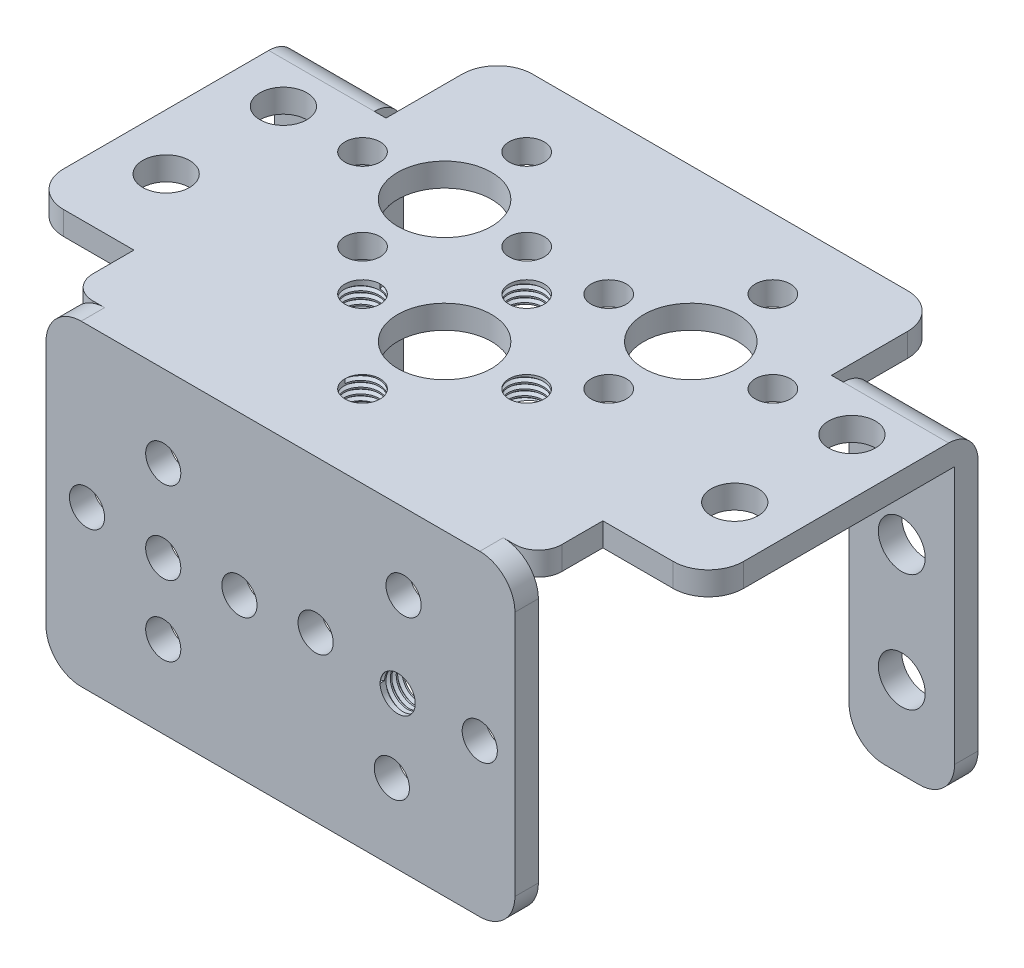
from build123d import *
from build123d.topology import SkipClean

# Parameters (mm, degrees)
SKETCH1_W           = 40
SKETCH1_H           = 27
SKETCH1_R           = 1.5
BOSS_EXTRUDE1_DEPTH = 2
FILLET1_R           = 3
SKETCH3_R           = 2
SKETCH3_R_2         = 4
SKETCH3_R_3         = 1.5
BOSS_EXTRUDE4_DEPTH = 2
FILLET2_R           = 3
FILLET4_R           = 2
SKETCH10_R          = 2
BOSS_EXTRUDE5_DEPTH = 2
FILLET5_R           = 2.5
THREAD1_PITCH       = 0.5
CIRPATTERN1_COUNT   = 4
THREAD2_PITCH       = 0.5


with BuildPart() as part:
    # Sketch1 → Boss-Extrude1 (new body)
    with BuildSketch(Plane.XY):
        Rectangle(SKETCH1_W, SKETCH1_H)
        with Locations((-10, -0.5)):
            Circle(SKETCH1_R, mode=Mode.SUBTRACT)
        with Locations(Location((10, -0.5, 0), (0, 0, 180))):
            Circle(SKETCH1_R, mode=Mode.SUBTRACT)
        with Locations((-10, 6.5)):
            Circle(SKETCH1_R, mode=Mode.SUBTRACT)
        with Locations((-3.5, 0)):
            Circle(SKETCH1_R, mode=Mode.SUBTRACT)
        with Locations((-10, -6.5)):
            Circle(SKETCH1_R, mode=Mode.SUBTRACT)
        with Locations((-16.5, 0)):
            Circle(SKETCH1_R, mode=Mode.SUBTRACT)
        with Locations((17, -0.5)):
            Circle(SKETCH1_R, mode=Mode.SUBTRACT)
        with Locations((9.5, -7)):
            Circle(SKETCH1_R, mode=Mode.SUBTRACT)
        with Locations((3, 0.5)):
            Circle(SKETCH1_R, mode=Mode.SUBTRACT)
        with Locations((10.5, 7)):
            Circle(SKETCH1_R, mode=Mode.SUBTRACT)
    extrude(amount=BOSS_EXTRUDE1_DEPTH)

    # Fillet1
    fillet1_edges = [part.edges().sort_by_distance(p)[0] for p in [
        (20, -13.5, 1),
        (-20, -13.5, 1),
        (-20, 13.5, 1),
        (20, 13.5, 1),
    ]]
    fillet(fillet1_edges, radius=FILLET1_R)

    # Sketch3 → Boss-Extrude4 (add)
    with BuildSketch(Plane(origin=(0, 13.5, 0), x_dir=(1, 0, 0), z_dir=(0, 1, 0))):
        with BuildLine():
            Line((-20, 0), (-20, 5.5))
            Line((-20, 5.5), (-26, 5.5))
            ThreePointArc((-26, 5.5), (-28.121320344, 6.378679656), (-29, 8.5))
            Line((-29, 8.5), (-29, 28.5))
            Line((-29, 28.5), (-20, 28.5))
            Line((-20, 28.5), (-20, 26))
            Line((-20, 26), (-19, 26))
            Line((-19, 26), (-19, 35.5))
            Line((-19, 35.5), (19, 35.5))
            Line((19, 35.5), (19, 26))
            Line((19, 26), (20, 26))
            Line((20, 26), (20, 28.5))
            Line((20, 28.5), (29, 28.5))
            Line((29, 28.5), (29, 8.5))
            ThreePointArc((29, 8.5), (28.121320344, 6.378679656), (26, 5.5))
            Line((26, 5.5), (20, 5.5))
            Line((20, 5.5), (20, 0))
            Line((20, 0), (-20, 0))
        make_face()
        with Locations(Location((-24.25, 22.5, 0), (0, 0, 270))):
            Circle(SKETCH3_R, mode=Mode.SUBTRACT)
        with Locations(Location((-24.25, 12.5, 0), (0, 0, 270))):
            Circle(SKETCH3_R, mode=Mode.SUBTRACT)
        with Locations(Location((24.25, 12.5, 0), (0, 0, 90))):
            Circle(SKETCH3_R, mode=Mode.SUBTRACT)
        with Locations(Location((24.25, 22.5, 0), (0, 0, 90))):
            Circle(SKETCH3_R, mode=Mode.SUBTRACT)
        with Locations(Location((-10.5, 22.5, 0), (0, 0, 270))):
            Circle(SKETCH3_R_2, mode=Mode.SUBTRACT)
        with Locations(Location((10.5, 22.5, 0), (0, 0, 90))):
            Circle(SKETCH3_R_2, mode=Mode.SUBTRACT)
        with Locations(Location((-10.5, 29.5, 0), (0, 0, 270))):
            Circle(SKETCH3_R_3, mode=Mode.SUBTRACT)
        with Locations(Location((-3.5, 22.5, 0), (0, 0, 270))):
            Circle(SKETCH3_R_3, mode=Mode.SUBTRACT)
        with Locations(Location((-10.5, 15.5, 0), (0, 0, 270))):
            Circle(SKETCH3_R_3, mode=Mode.SUBTRACT)
        with Locations(Location((-17.5, 22.5, 0), (0, 0, 270))):
            Circle(SKETCH3_R_3, mode=Mode.SUBTRACT)
        with Locations(Location((10.5, 29.5, 0), (0, 0, 270))):
            Circle(SKETCH3_R_3, mode=Mode.SUBTRACT)
        with Locations(Location((17.5, 22.5, 0), (0, 0, 270))):
            Circle(SKETCH3_R_3, mode=Mode.SUBTRACT)
        with Locations(Location((10.5, 15.5, 0), (0, 0, 270))):
            Circle(SKETCH3_R_3, mode=Mode.SUBTRACT)
        with Locations(Location((3.5, 22.5, 0), (0, 0, 270))):
            Circle(SKETCH3_R_3, mode=Mode.SUBTRACT)
        with Locations(Location((0, 12, 0), (0, 0, 270))):
            Circle(SKETCH3_R_2, mode=Mode.SUBTRACT)
        with Locations(Location((0, 19, 0), (0, 0, 270))):
            Circle(SKETCH3_R_3, mode=Mode.SUBTRACT)
        with Locations(Location((7, 12, 0), (0, 0, 270))):
            Circle(SKETCH3_R_3, mode=Mode.SUBTRACT)
        with Locations(Location((0, 5, 0), (0, 0, 270))):
            Circle(SKETCH3_R_3, mode=Mode.SUBTRACT)
        with Locations(Location((-7, 12, 0), (0, 0, 270))):
            Circle(SKETCH3_R_3, mode=Mode.SUBTRACT)
    extrude(amount=-BOSS_EXTRUDE4_DEPTH)

    # Fillet2
    fillet2_edges = [part.edges().sort_by_distance(p)[0] for p in [
        (-19, 12.5, -35.5),
        (19, 12.5, -35.5),
    ]]
    fillet(fillet2_edges, radius=FILLET2_R)

    # Fillet4
    # the kernel refuses this fillet: 2 mm, written as the material it takes off along each edge
    with BuildSketch(Plane(origin=(20, 18.5, 0), x_dir=(-1, 0, 0), z_dir=(0, -1, 0)), Plane(origin=(-20, 18.5, 0), x_dir=(0, 0, -1), z_dir=(0, -1, 0))) as fillet4_piece_1:
        with BuildLine():
            CenterArc((FILLET4_R, FILLET4_R), FILLET4_R, 180, 90)
            Line((0, FILLET4_R), (0, 0))
            Line((0, 0), (FILLET4_R, 0))
        make_face()
    extrude(amount=12, mode=Mode.SUBTRACT)

    # Sketch10 → Boss-Extrude5 (add)
    # profile 1 of 2: a face of its own
    with BuildSketch(Plane(origin=(0, 0, -28.5), x_dir=(-1, 0, 0), z_dir=(0, 0, -1))):
        with BuildLine():
            Line((29, 11.5), (29, -9.5))
            ThreePointArc((29, -9.5), (28.121320344, -11.621320344), (26, -12.5))
            Line((26, -12.5), (23, -12.5))
            ThreePointArc((23, -12.5), (20.878679656, -11.621320344), (20, -9.5))
            Line((20, -9.5), (20, 13.5))
            Line((20, 13.5), (29, 13.5))
            Line((29, 13.5), (29, 11.5))
        make_face()
        with Locations((24.5, -6.5)):
            Circle(SKETCH10_R, mode=Mode.SUBTRACT)
        with Locations((24.5, 3.5)):
            Circle(SKETCH10_R, mode=Mode.SUBTRACT)
    # profile 2 of 2: a face of its own
    with BuildSketch(Plane(origin=(0, 0, -28.5), x_dir=(-1, 0, 0), z_dir=(0, 0, -1))):
        with BuildLine():
            Line((-29, 13.5), (-29, -10.5))
            ThreePointArc((-29, -10.5), (-28.121320344, -12.621320344), (-26, -13.5))
            Line((-26, -13.5), (-23, -13.5))
            ThreePointArc((-23, -13.5), (-20.878679656, -12.621320344), (-20, -10.5))
            Line((-20, -10.5), (-20, 13.5))
            Line((-20, 13.5), (-29, 13.5))
        make_face()
        with Locations(Location((-24.5, 3.5, 0), (0, 0, 180))):
            Circle(SKETCH10_R, mode=Mode.SUBTRACT)
        with Locations(Location((-24.5, -6.5, 0), (0, 0, 180))):
            Circle(SKETCH10_R, mode=Mode.SUBTRACT)
    extrude(amount=-BOSS_EXTRUDE5_DEPTH)

    # Fillet5
    fillet5_edges = [part.edges().sort_by_distance(p)[0] for p in [
        (-24.5, 13.5, -28.5),
        (24.5, 13.5, -28.5),
    ]]
    fillet(fillet5_edges, radius=FILLET5_R)

    # Thread1: the profile of Thread Profile1 profile screwed along a right-hand helix of 4 turns, 6 arcs to a turn; built about Z, then put on its axis
    with SkipClean():  # the faces are left unmerged after this step: merging them gives an invalid solid
        thread1_z = Axis((0, 0, 0), (0, 0, 1))
        thread1_corners = [(1.4997, 0, -0.000173205), (1.770632937, 0, 0.156249999), (1.770632937, 0, 0.218749999), (1.4997, 0, 0.375173204)]
        with BuildLine(mode=Mode.PRIVATE) as thread1_profile:
            Line(thread1_corners[0], thread1_corners[1])
            Line(thread1_corners[1], thread1_corners[2])
            Line(thread1_corners[2], thread1_corners[3])
            Line(thread1_corners[3], thread1_corners[0])
        thread1_cap = Face(thread1_profile.wire())
        thread1_turn_angles = [0, 30, 60, 90, 120, 150, 180, 210, 240, 270, 300, 330, 360]
        thread1_turn_weights = [1, 0.8660254037844387, 1, 0.8660254037844387, 1, 0.8660254037844387, 1, 0.8660254037844387, 1, 0.8660254037844387, 1, 0.8660254037844387, 1]
        thread1_turn_rails = [Edge.make_bspline([Vector(p[0], p[1], 0).rotate(thread1_z, thread1_turn_angles[k]) / thread1_turn_weights[k] + Vector(0, 0, p[2] + THREAD1_PITCH * thread1_turn_angles[k] / 360) for k in range(13)], [0, 0, 0, 1, 1, 2, 2, 3, 3, 4, 4, 5, 5, 6, 6, 6], 2, thread1_turn_weights) for p in thread1_corners]
        thread1_turn_sides = [Face.make_surface_from_curves(thread1_turn_rails[p[0]], thread1_turn_rails[p[1]]) for p in [(0, 1), (1, 2), (2, 3), (3, 0)]]
        thread1 = Plane(origin=(0, 13.5, -5), x_dir=(-1, 0, 0), z_dir=(0, -1, 0)) * Solid(Shell([*[p.moved(Location((0, 0, THREAD1_PITCH * i))) for i in range(4) for p in thread1_turn_sides], thread1_cap, thread1_cap.rotate(thread1_z, 1440).moved(Location((0, 0, THREAD1_PITCH * 1440 / 360)))]))
        add(thread1, mode=Mode.SUBTRACT)

    # CirPattern1: Thread1 ×4 about axis
    with SkipClean():  # the faces are left unmerged after this step: merging them gives an invalid solid
        cirpattern1_axis = Axis((0, 11.5, -12), (0, 1, 0))
        for i in range(1, CIRPATTERN1_COUNT):
            add(thread1.rotate(cirpattern1_axis, i * 360 / CIRPATTERN1_COUNT), mode=Mode.SUBTRACT)

    # Thread2: the profile of Thread Profile2 profile screwed along a right-hand helix of 4 turns, 6 arcs to a turn; built about Z, then put on its axis
    with SkipClean():  # the faces are left unmerged after this step: merging them gives an invalid solid
        thread2_z = Axis((0, 0, 0), (0, 0, 1))
        thread2_corners = [(1.4997, 0, -0.000173205), (1.770632938, 0, 0.156249999), (1.770632938, 0, 0.218749999), (1.4997, 0, 0.375173204)]
        with BuildLine(mode=Mode.PRIVATE) as thread2_profile:
            Line(thread2_corners[0], thread2_corners[1])
            Line(thread2_corners[1], thread2_corners[2])
            Line(thread2_corners[2], thread2_corners[3])
            Line(thread2_corners[3], thread2_corners[0])
        thread2_cap = Face(thread2_profile.wire())
        thread2_turn_angles = [0, 30, 60, 90, 120, 150, 180, 210, 240, 270, 300, 330, 360]
        thread2_turn_weights = [1, 0.8660254037844387, 1, 0.8660254037844387, 1, 0.8660254037844387, 1, 0.8660254037844387, 1, 0.8660254037844387, 1, 0.8660254037844387, 1]
        thread2_turn_rails = [Edge.make_bspline([Vector(p[0], p[1], 0).rotate(thread2_z, thread2_turn_angles[k]) / thread2_turn_weights[k] + Vector(0, 0, p[2] + THREAD2_PITCH * thread2_turn_angles[k] / 360) for k in range(13)], [0, 0, 0, 1, 1, 2, 2, 3, 3, 4, 4, 5, 5, 6, 6, 6], 2, thread2_turn_weights) for p in thread2_corners]
        thread2_turn_sides = [Face.make_surface_from_curves(thread2_turn_rails[p[0]], thread2_turn_rails[p[1]]) for p in [(0, 1), (1, 2), (2, 3), (3, 0)]]
        thread2 = Plane(origin=(10, -0.5, 2), x_dir=(-1, 0, 0), z_dir=(0, 0, -1)) * Solid(Shell([*[p.moved(Location((0, 0, THREAD2_PITCH * i))) for i in range(4) for p in thread2_turn_sides], thread2_cap, thread2_cap.rotate(thread2_z, 1440).moved(Location((0, 0, THREAD2_PITCH * 1440 / 360)))]))
        add(thread2, mode=Mode.SUBTRACT)


solid = part.part
